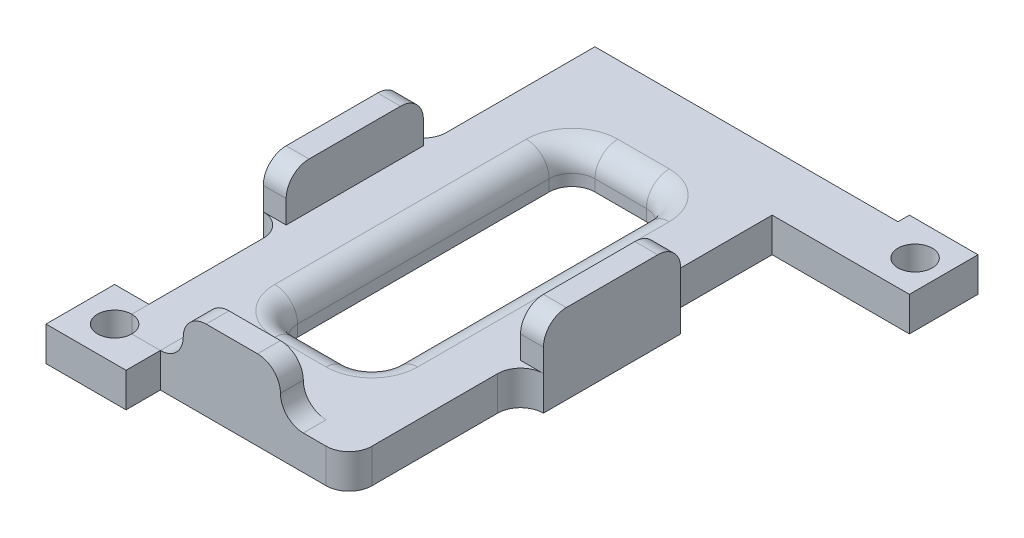
from build123d import *

# Parameters (mm, degrees)
EXTRUDE_1_DEPTH     = 3
SKETCH_3_W          = 8.5
SKETCH_3_H          = 2
EXTRUDE_2_DEPTH     = 4
SKETCH_4_W          = 2
SKETCH_4_H          = 12
EXTRUDE_3_DEPTH     = 4
FILLET_1_R          = 2
FILLET_2_R          = 2
FILLET_3_R          = 2
SKETCH_5_W          = 8.5
SKETCH_5_H          = 26
CUT_EXTRUDE_1_DEPTH = 4
FILLET_4_R          = 2
EXTRUDE_4_DEPTH     = 3
SKETCH_9_W          = 5
SKETCH_9_H          = 3
EXTRUDE_5_DEPTH     = 12
SKETCH_8_R          = 1.5
CUT_EXTRUDE_2_DEPTH = 12
SKETCH_10_W         = 6
SKETCH_10_H         = 3
EXTRUDE_6_DEPTH     = 1


with BuildPart() as part:
    # 草图1 → 凸台-拉伸1 (new body)
    with BuildSketch(Plane(origin=(0, 0, 0), x_dir=(1, 0, 0), z_dir=(0, 1, 0))):
        Polygon((0, 0), (-20.5, 0), (-20.5, 15), (-22.5, 15), (-22.5, 27), (-20.5, 27), (-20.5, 42), (0, 42), (0, 27), (2, 27), (2, 15), (0, 15), align=None)
    extrude(amount=EXTRUDE_1_DEPTH)

    # 草图3 → 凸台-拉伸2 (add)
    with BuildSketch(Plane(origin=(0, 3, 0), x_dir=(1, 0, 0), z_dir=(0, 1, 0))):
        with Locations((-10.25, 1)):
            Rectangle(SKETCH_3_W, SKETCH_3_H)
    extrude(amount=EXTRUDE_2_DEPTH)

    # 草图4 → 凸台-拉伸3 (add)
    with BuildSketch(Plane(origin=(0, 3, 0), x_dir=(1, 0, 0), z_dir=(0, 1, 0))):
        with Locations((-21.5, 21)):
            Rectangle(SKETCH_4_W, SKETCH_4_H)
        with Locations((1, 21)):
            Rectangle(SKETCH_4_W, SKETCH_4_H)
    extrude(amount=EXTRUDE_3_DEPTH)

    # 圆角1
    fillet_1_edges = [part.edges().sort_by_distance(p)[0] for p in [
        (-14.5, 7, -1),
        (-6, 7, -1),
        (-21.5, 7, -15),
        (-21.5, 7, -27),
        (1, 7, -15),
        (1, 7, -27),
    ]]
    fillet(fillet_1_edges, radius=FILLET_1_R)

    # 圆角2
    fillet_2_edges = [part.edges().sort_by_distance(p)[0] for p in [
        (0, 1.5, 0),
    ]]
    fillet(fillet_2_edges, radius=FILLET_2_R)

    # 圆角3
    # the kernel refuses this fillet: 2 mm, written as the material it adds along each edge
    with BuildSketch(Plane(origin=(-6, 3, 0), x_dir=(1, 0, 0), z_dir=(0, 0, -1)), Plane(origin=(-14.5, 3, -2), x_dir=(-1, 0, 0), z_dir=(0, 0, 1))) as fillet_3_piece_1:
        with BuildLine():
            CenterArc((FILLET_3_R, -FILLET_3_R), FILLET_3_R, 90, 90)
            Line((0, -FILLET_3_R), (0, 0))
            Line((0, 0), (FILLET_3_R, 0))
        make_face()
    extrude(amount=2)
    with BuildSketch(Plane(origin=(-20.5, 0, -15), x_dir=(0, 0, 1), z_dir=(0, 1, 0)), Plane(origin=(0, 0, -27), x_dir=(0, 0, -1), z_dir=(0, 1, 0))) as fillet_3_piece_2:
        with BuildLine():
            CenterArc((FILLET_3_R, -FILLET_3_R), FILLET_3_R, 90, 90)
            Line((0, -FILLET_3_R), (0, 0))
            Line((0, 0), (FILLET_3_R, 0))
        make_face()
    extrude(amount=3)
    with BuildSketch(Plane(origin=(-20.5, 0, -27), x_dir=(0, 0, -1), z_dir=(0, 1, 0)), Plane(origin=(0, 0, -15), x_dir=(0, 0, 1), z_dir=(0, 1, 0))) as fillet_3_piece_3:
        with BuildLine():
            CenterArc((FILLET_3_R, FILLET_3_R), FILLET_3_R, 180, 90)
            Line((0, FILLET_3_R), (0, 0))
            Line((0, 0), (FILLET_3_R, 0))
        make_face()
    extrude(amount=3)

    # 草图5 → 切除-拉伸1 (cut)
    with BuildSketch(Plane(origin=(0, 3, 0), x_dir=(1, 0, 0), z_dir=(0, 1, 0))):
        with Locations((-10.25, 21)):
            Rectangle(SKETCH_5_W, SKETCH_5_H)
    extrude(amount=-CUT_EXTRUDE_1_DEPTH, mode=Mode.SUBTRACT)

    # 圆角4
    fillet_4_edges = [part.edges().sort_by_distance(p)[0] for p in [
        (-14.5, 1.5, -8),
        (-14.5, 1.5, -34),
        (-6, 1.5, -34),
        (-6, 1.5, -8),
        (-14.5, 3, -21),
        (-10.25, 3, -8),
        (-6, 3, -21),
        (-10.25, 3, -34),
    ]]
    fillet(fillet_4_edges, radius=FILLET_4_R)

    # 草图9 → 凸台-拉伸5 (add)
    with BuildSketch(Plane(origin=(0, 0, 0), x_dir=(0, 0, -1), z_dir=(1, 0, 0))):
        with Locations((39.5, 1.5)):
            Rectangle(SKETCH_9_W, SKETCH_9_H)
    extrude(amount=EXTRUDE_5_DEPTH)


with BuildPart() as body_2:
    # 草图7 → 凸台-拉伸4 (new body)
    with BuildSketch(Plane(origin=(0, 3, 0), x_dir=(1, 0, 0), z_dir=(0, 1, 0))):
        Polygon((-16.5, 0), (-16.5, -3), (-23.5, -3), (-23.5, 3), (-20.5, 3), (-20.5, 0), align=None)
    extrude(amount=-EXTRUDE_4_DEPTH)


with BuildPart() as cut_extrude_2_tool:
    # 草图8 → 切除-拉伸2 (new body)
    with BuildSketch(Plane(origin=(0, 3, 0), x_dir=(1, 0, 0), z_dir=(0, 1, 0))):
        with Locations((-20.5, 0)):
            Circle(SKETCH_8_R)
        with Locations(Location((9.5, 40, 0), (0, 0, 270))):
            Circle(SKETCH_8_R)
    extrude(amount=-CUT_EXTRUDE_2_DEPTH)


with BuildPart() as part_1:
    add(part.part)

    # 切除-拉伸2: cut by cut_extrude_2_tool
    add(cut_extrude_2_tool.part, mode=Mode.SUBTRACT)

    # 草图10 → 凸台-拉伸6 (add)
    with BuildSketch(Plane(origin=(0, 0, -42), x_dir=(-1, 0, 0), z_dir=(0, 0, -1))):
        with Locations((-9, 1.5)):
            Rectangle(SKETCH_10_W, SKETCH_10_H)
    extrude(amount=EXTRUDE_6_DEPTH)


with BuildPart() as body_2_1:
    add(body_2.part)

    # 切除-拉伸2: cut by cut_extrude_2_tool
    add(cut_extrude_2_tool.part, mode=Mode.SUBTRACT)


solid = Compound([part_1.part, body_2_1.part])
